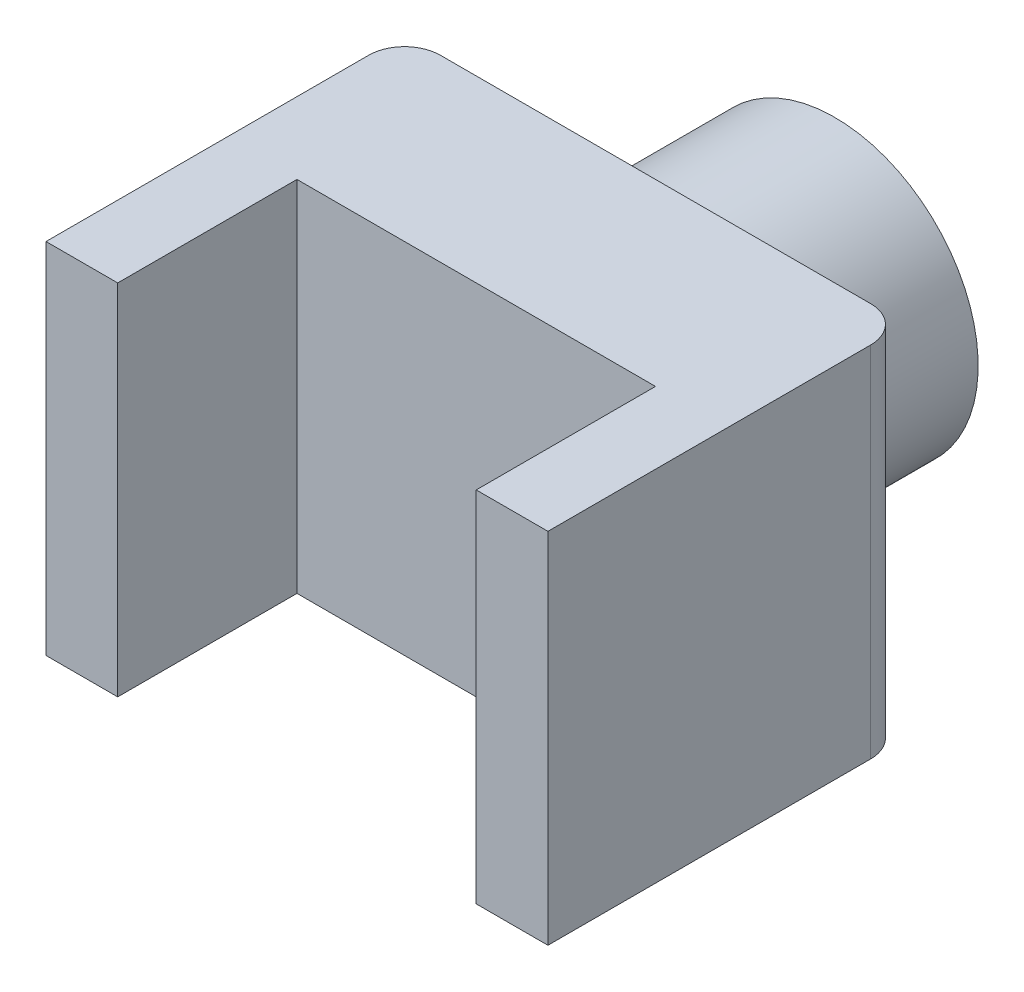
from build123d import *

# Parameters (mm, degrees)
ESQUISSE1_W             = 14
ESQUISSE1_H             = 10
BOSS_EXTRU_1_DEPTH      = 10
ESQUISSE4_R             = 4
BOSS_EXTRU_2_DEPTH      = 5
ESQUISSE5_R             = 2.5
ENL_V_MAT_EXTRU_2_DEPTH = 5
CONG_3_R                = 1
CONG_4_R                = 1
ESQUISSE6_W             = 10
ESQUISSE6_H             = 10
ENL_V_MAT_EXTRU_3_DEPTH = 5


with BuildPart() as part:
    # Esquisse1 → Boss.-Extru.1 (new body)
    with BuildSketch(Plane.XY):
        with Locations((7, 5)):
            Rectangle(ESQUISSE1_W, ESQUISSE1_H)
    extrude(amount=BOSS_EXTRU_1_DEPTH)

    # Esquisse4 → Boss.-Extru.2 (add)
    with BuildSketch(Plane(origin=(0, 0, 0), x_dir=(-1, 0, 0), z_dir=(0, 0, -1))):
        with Locations((-7, 5)):
            Circle(ESQUISSE4_R)
    extrude(amount=BOSS_EXTRU_2_DEPTH)

    # Esquisse5 → Enlèv. mat.-Extru.2 (cut)
    with BuildSketch(Plane(origin=(0, 0, -5), x_dir=(-1, 0, 0), z_dir=(0, 0, -1))):
        with Locations((-7, 5)):
            Circle(ESQUISSE5_R)
    extrude(amount=-ENL_V_MAT_EXTRU_2_DEPTH, mode=Mode.SUBTRACT)

    # Congé3
    cong_3_edges = [part.edges().sort_by_distance(p)[0] for p in [
        (11, 5, 0),
    ]]
    fillet(cong_3_edges, radius=CONG_3_R - 0.0001)  # a hair under: the kernel refuses the full size

    # Congé4
    cong_4_edges = [part.edges().sort_by_distance(p)[0] for p in [
        (14, 5, 0),
        (0, 5, 0),
    ]]
    fillet(cong_4_edges, radius=CONG_4_R)

    # Esquisse6 → Enlèv. mat.-Extru.3 (cut)
    with BuildSketch(Plane.XY.offset(10)):
        with Locations((7, 5)):
            Rectangle(ESQUISSE6_W, ESQUISSE6_H)
    extrude(amount=-ENL_V_MAT_EXTRU_3_DEPTH, mode=Mode.SUBTRACT)


solid = part.part
